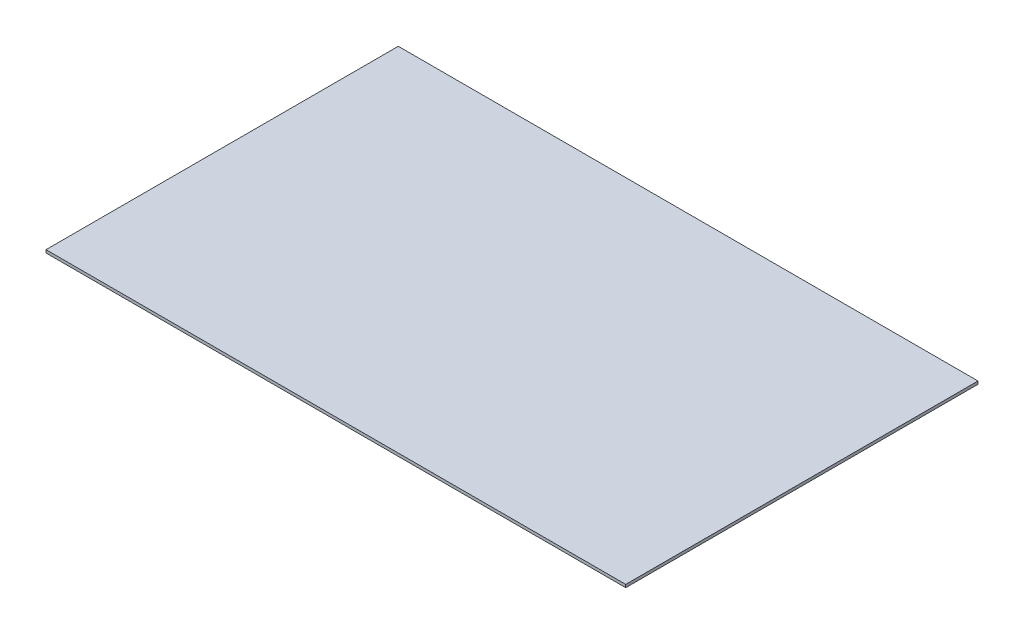
from build123d import *

# Parameters (mm, degrees)
SKETCH1_W           = 300
SKETCH1_H           = 182.3
BOSS_EXTRUDE1_DEPTH = 1.5


with BuildPart() as part:
    # Sketch1 → Boss-Extrude1 (new body)
    with BuildSketch(Plane(origin=(0, 0, 0), x_dir=(1, 0, 0), z_dir=(0, 1, 0))):
        Rectangle(SKETCH1_W, SKETCH1_H)
    extrude(amount=BOSS_EXTRUDE1_DEPTH)


solid = part.part
